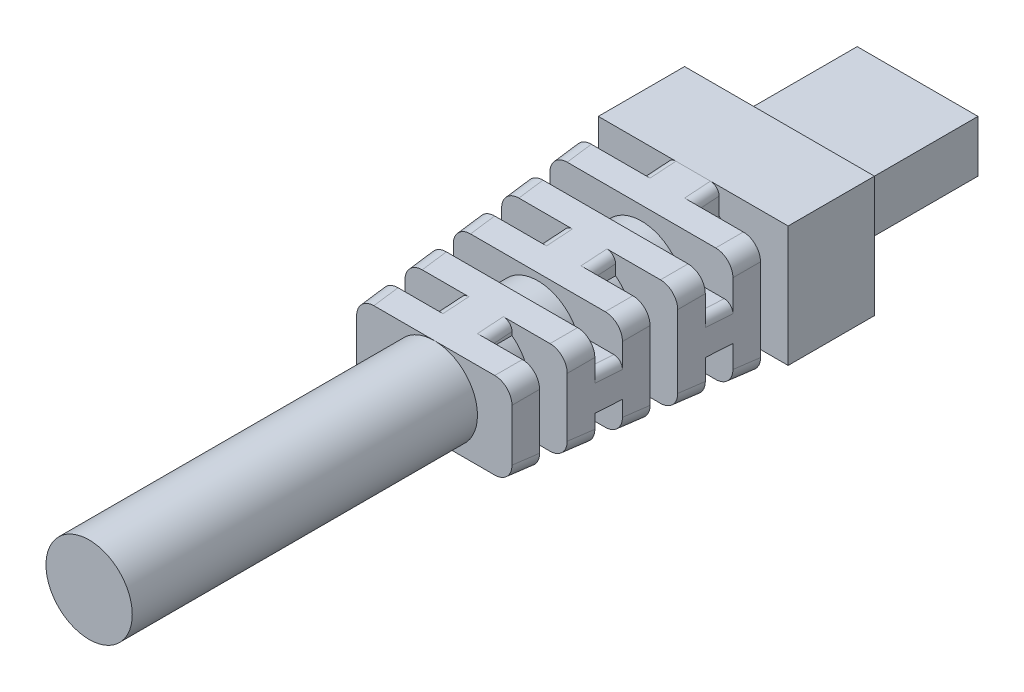
from build123d import *
from OCP.BRepFilletAPI import BRepFilletAPI_MakeChamfer

# Parameters (mm, degrees)
SKETCH1_W                = 7
SKETCH1_H                = 3
BOSS_EXTRUDE1_DEPTH      = 8
SKETCH2_W                = 11
SKETCH2_H                = 7
BOSS_EXTRUDE2_DEPTH      = 20
CHAMFER2_SIZE            = 15
CHAMFER2_SIZE2           = 1
SKETCH5_W                = 1.5
SKETCH5_H                = 2.5
CUT_EXTRUDE2_DEPTH       = 4
FILLET2_R                = 1
SKETCH6_W                = 1.5
SKETCH6_H                = 2
CUT_EXTRUDE3_DEPTH       = 4
SKETCH7_W                = 3
SKETCH7_H                = 1.5
CUT_EXTRUDE4_DEPTH       = 2.5
BOSS_EXTRUDE4_DEPTH      = 20
BOSS_EXTRUDE4_DEPTH_BACK = 20
SKETCH8_R                = 2.5
FILLET3_R                = 0.5


with BuildPart() as part:
    # Sketch1 → Boss-Extrude1 (new body)
    with BuildSketch(Plane.XY):
        with Locations((-57.846738576, -21.572369878)):
            Rectangle(SKETCH1_W, SKETCH1_H)
    extrude(amount=BOSS_EXTRUDE1_DEPTH)

    # Sketch2 → Boss-Extrude2 (add)
    with BuildSketch(Plane.XY.offset(8)):
        with Locations((-57.846738576, -21.572369878)):
            Rectangle(SKETCH2_W, SKETCH2_H)
    extrude(amount=BOSS_EXTRUDE2_DEPTH)

    # Chamfer2: one chamfer whose edges measure the first distance from different faces: ONE call of the kernel's chamfer builder (chamfer() names one face for all edges)
    chamfer2_edges_1 = [part.edges().sort_by_distance(p)[0] for p in [
        (-63.346738576, -21.572369878, 28),
    ]]
    chamfer2_side_1 = [part.faces().sort_by_distance(p)[0] for p in [
        (-63.346738576, -21.572369878, 18),
    ]]
    chamfer2_edges_2 = [part.edges().sort_by_distance(p)[0] for p in [
        (-57.846738576, -25.072369878, 28),
    ]]
    chamfer2_side_2 = [part.faces().sort_by_distance(p)[0] for p in [
        (-57.846738576, -25.072369878, 18),
    ]]
    chamfer2_edges_3 = [part.edges().sort_by_distance(p)[0] for p in [
        (-52.346738576, -21.572369878, 28),
    ]]
    chamfer2_side_3 = [part.faces().sort_by_distance(p)[0] for p in [
        (-52.346738576, -21.572369878, 18),
    ]]
    chamfer2_edges_4 = [part.edges().sort_by_distance(p)[0] for p in [
        (-57.846738576, -18.072369878, 28),
    ]]
    chamfer2_side_4 = [part.faces().sort_by_distance(p)[0] for p in [
        (-57.846738576, -18.072369878, 18),
    ]]
    chamfer2 = BRepFilletAPI_MakeChamfer(part.part.solid().wrapped)
    for e in chamfer2_edges_1:
        chamfer2.Add(CHAMFER2_SIZE, CHAMFER2_SIZE2, e.wrapped, chamfer2_side_1[0].wrapped)  # the first distance lies on this face
    for e in chamfer2_edges_2:
        chamfer2.Add(CHAMFER2_SIZE, CHAMFER2_SIZE2, e.wrapped, chamfer2_side_2[0].wrapped)  # the first distance lies on this face
    for e in chamfer2_edges_3:
        chamfer2.Add(CHAMFER2_SIZE, CHAMFER2_SIZE2, e.wrapped, chamfer2_side_3[0].wrapped)  # the first distance lies on this face
    for e in chamfer2_edges_4:
        chamfer2.Add(CHAMFER2_SIZE, CHAMFER2_SIZE2, e.wrapped, chamfer2_side_4[0].wrapped)  # the first distance lies on this face
    add(Compound.cast(chamfer2.Shape()), mode=Mode.REPLACE)

    # Sketch5 → Cut-Extrude2 (cut)
    with BuildSketch(Plane(origin=(-52.346738576, 0, 0), x_dir=(0, 0, -1), z_dir=(1, 0, 0))):
        with Locations((-25.75, -19.322369878)):
            Rectangle(SKETCH5_W, SKETCH5_H)
        with Locations((-22.75, -19.322369878)):
            Rectangle(SKETCH5_W, SKETCH5_H)
        with Locations((-19.75, -19.322369878)):
            Rectangle(SKETCH5_W, SKETCH5_H)
        with Locations((-16.75, -19.322369878)):
            Rectangle(SKETCH5_W, SKETCH5_H)
        with Locations((-13.75, -19.322369878)):
            Rectangle(SKETCH5_W, SKETCH5_H)
        with Locations((-22.75, -23.822369878)):
            Rectangle(SKETCH5_W, SKETCH5_H)
        with Locations((-19.75, -23.822369878)):
            Rectangle(SKETCH5_W, SKETCH5_H)
        with Locations((-16.75, -23.822369878)):
            Rectangle(SKETCH5_W, SKETCH5_H)
        with Locations((-13.75, -23.822369878)):
            Rectangle(SKETCH5_W, SKETCH5_H)
        with Locations((-25.75, -23.822369878)):
            Rectangle(SKETCH5_W, SKETCH5_H)
    cut_extrude2 = extrude(amount=-CUT_EXTRUDE2_DEPTH, mode=Mode.SUBTRACT)

    # Mirror2: Cut-Extrude2 across plane
    add(cut_extrude2.mirror(Plane(origin=(-57.846738576, 0, 0), x_dir=(0, 0, 1), z_dir=(1, 0, 0))), mode=Mode.SUBTRACT)

    # Fillet2
    fillet2_edges = [part.edges().sort_by_distance(p)[0] for p in [
        (-52.496738576, -18.222369878, 15.25),
        (-53.096738576, -24.322369878, 24.25),
        (-52.896738576, -24.522369878, 21.25),
        (-52.696738576, -24.722369878, 18.25),
        (-52.496738576, -24.922369878, 15.25),
        (-53.296738576, -24.122369878, 27.25),
        (-62.596738576, -18.822369878, 24.25),
        (-62.796738576, -18.622369878, 21.25),
        (-62.996738576, -18.422369878, 18.25),
        (-63.196738576, -18.222369878, 15.25),
        (-62.796738576, -24.522369878, 21.25),
        (-62.996738576, -24.722369878, 18.25),
        (-63.196738576, -24.922369878, 15.25),
        (-62.396738576, -19.022369878, 27.25),
        (-62.396738576, -24.122369878, 27.25),
        (-62.596738576, -24.322369878, 24.25),
        (-53.296738576, -19.022369878, 27.25),
        (-53.096738576, -18.822369878, 24.25),
        (-52.896738576, -18.622369878, 21.25),
        (-52.696738576, -18.422369878, 18.25),
    ]]
    fillet(fillet2_edges, radius=FILLET2_R)

    # Sketch6 → Cut-Extrude3 (cut)
    with BuildSketch(Plane.ZY.offset(63.346738576)):
        with Locations((13.75, -21.572369878)):
            Rectangle(SKETCH6_W, SKETCH6_H)
        with Locations((19.75, -21.572369878)):
            Rectangle(SKETCH6_W, SKETCH6_H)
        with Locations((25.75, -21.572369878)):
            Rectangle(SKETCH6_W, SKETCH6_H)
    cut_extrude3 = extrude(amount=-CUT_EXTRUDE3_DEPTH, mode=Mode.SUBTRACT)

    # Mirror3: Cut-Extrude3 across plane
    add(cut_extrude3.mirror(Plane(origin=(-57.846738576, 0, 0), x_dir=(0, 0, 1), z_dir=(1, 0, 0))), mode=Mode.SUBTRACT)

    # Sketch7 → Cut-Extrude4 (cut)
    with BuildSketch(Plane(origin=(0, -18.072369878, 0), x_dir=(1, 0, 0), z_dir=(0, 1, 0))):
        with Locations((-57.846738576, -16.75)):
            Rectangle(SKETCH7_W, SKETCH7_H)
        with Locations((-57.846738576, -22.75)):
            Rectangle(SKETCH7_W, SKETCH7_H)
    cut_extrude4 = extrude(amount=-CUT_EXTRUDE4_DEPTH, mode=Mode.SUBTRACT)

    # Mirror4: Cut-Extrude4 across plane
    add(cut_extrude4.mirror(Plane.ZX.offset(-21.572369878)), mode=Mode.SUBTRACT)

    # Sketch8 → Boss-Extrude4 (add, two sides: drawn at the far end of the back side and taken through both)
    with BuildSketch(Plane.XY.offset(28).offset(-BOSS_EXTRUDE4_DEPTH_BACK)):
        with Locations(Location((-57.846738576, -21.572369878, 0), (0, 0, 270))):
            Circle(SKETCH8_R)
    extrude(amount=BOSS_EXTRUDE4_DEPTH + BOSS_EXTRUDE4_DEPTH_BACK)

    # Fillet3
    # the kernel refuses this fillet: 0.5 mm, written as the material it adds along each edge
    with BuildSketch(Plane(origin=(-59.346738576, -23.572369878, 12.409830056), x_dir=(0, -1, 0), z_dir=(0, 0, 1))) as fillet3_piece_1:
        with BuildLine():
            CenterArc((0.236067977, -0.5), FILLET3_R, 90, 48.189685104)
            ThreePointArc((-0.136610019, -0.166666667), (-0.066508345, -0.084805988), (0, 0))
            Line((0, 0), (0.236067977, 0))
        make_face()
    extrude(amount=2.680339887)
    with BuildSketch(Plane(origin=(-59.346738576, -19.572369878, 12.409830056), x_dir=(-0.7733966621339653, -0.633922395092681, 0), z_dir=(0, 0, 1))) as fillet3_piece_2:
        with BuildLine():
            CenterArc((0.237049553, -0.499535383), FILLET3_R, 92.470208625, 48.189685104)
            Line((-0.149648778, -0.182574186), (0, 0))
            ThreePointArc((0, 0), (0.107749797, -0.002323083), (0.215499594, 0))
        make_face()
    extrude(amount=2.680339887)
    with BuildSketch(Plane(origin=(-59.346738576, -19.572369878, 18.409830056), x_dir=(0, 1, 0), z_dir=(0, 0, 1))) as fillet3_piece_3:
        with BuildLine():
            CenterArc((0.236067977, 0.5), FILLET3_R, 221.810314896, 48.189685104)
            ThreePointArc((-0.136610019, 0.166666667), (-0.066508345, 0.084805988), (0, 0))
            Line((0, 0), (0.236067977, 0))
        make_face()
    extrude(amount=2.680339887)
    with BuildSketch(Plane(origin=(-60.138026424, -20.572369878, 21.23302909), x_dir=(0.45070755855689565, 0.8926716622922913, 0), z_dir=(0, 0, 1))) as fillet3_piece_4:
        with BuildLine():
            CenterArc((0.308063997, 0.499215058), FILLET3_R, 206.789089239, 60)
            Line((-0.138271834, 0.273861279), (0, 0))
            ThreePointArc((0, 0), (0.140029089, 0.00392471), (0.280058179, 0))
        make_face()
    extrude(amount=3.033941819)
    # the kernel refuses this fillet: 0.5 mm, written as the material it takes off along each edge
    with BuildSketch(Plane(origin=(-56.346738576, -18.255518641, 15.747231447), x_dir=(-1, 0, 0), z_dir=(0, 0.06651901052377394, -0.9977851578566089))) as fillet3_2_piece_1_section:
        with BuildLine():
            CenterArc((FILLET3_R, -FILLET3_R), FILLET3_R, 90, 90)
            Line((0, -FILLET3_R), (0, 0))
            Line((0, 0), (FILLET3_R, 0))
        make_face()
    fillet3_2_piece_1 = extrude(amount=4.003329638, mode=Mode.PRIVATE)
    fillet3_2_piece_1 = split(fillet3_2_piece_1, bisect_by=Plane(origin=(-56.459936133, -18.235818707, 14.5), z_dir=(0, 0, -1)), keep=Keep.TOP, mode=Mode.PRIVATE)
    fillet3_2_piece_1 = split(fillet3_2_piece_1, bisect_by=Plane(origin=(-56.459936133, -18.235818707, 13), z_dir=(0, 0, 1)), keep=Keep.TOP, mode=Mode.PRIVATE)
    add(fillet3_2_piece_1, mode=Mode.SUBTRACT)
    with BuildSketch(Plane(origin=(-56.346738576, -24.755518641, 17.752768553), x_dir=(-1, 0, 0), z_dir=(0, 0.06651901052377394, 0.9977851578566089))) as fillet3_2_piece_2_section:
        with BuildLine():
            CenterArc((FILLET3_R, -FILLET3_R), FILLET3_R, 90, 90)
            Line((0, -FILLET3_R), (0, 0))
            Line((0, 0), (FILLET3_R, 0))
        make_face()
    fillet3_2_piece_2 = extrude(amount=4.003329638, mode=Mode.PRIVATE)
    fillet3_2_piece_2 = split(fillet3_2_piece_2, bisect_by=Plane(origin=(-56.459936133, -24.50892105, 19), z_dir=(0, 0, 1)), keep=Keep.TOP, mode=Mode.PRIVATE)
    fillet3_2_piece_2 = split(fillet3_2_piece_2, bisect_by=Plane(origin=(-56.459936133, -24.50892105, 20.5), z_dir=(0, 0, -1)), keep=Keep.TOP, mode=Mode.PRIVATE)
    add(fillet3_2_piece_2, mode=Mode.SUBTRACT)
    with BuildSketch(Plane(origin=(-56.346738576, -25.155518641, 11.752768553), x_dir=(-1, 0, 0), z_dir=(0, 0.06651901052377394, 0.9977851578566089))) as fillet3_2_piece_3_section:
        with BuildLine():
            CenterArc((FILLET3_R, -FILLET3_R), FILLET3_R, 90, 90)
            Line((0, -FILLET3_R), (0, 0))
            Line((0, 0), (FILLET3_R, 0))
        make_face()
    fillet3_2_piece_3 = extrude(amount=4.003329638, mode=Mode.PRIVATE)
    fillet3_2_piece_3 = split(fillet3_2_piece_3, bisect_by=Plane(origin=(-56.459936133, -24.90892105, 14.5), z_dir=(0, 0, -1)), keep=Keep.TOP, mode=Mode.PRIVATE)
    fillet3_2_piece_3 = split(fillet3_2_piece_3, bisect_by=Plane(origin=(-56.459936133, -24.90892105, 13), z_dir=(0, 0, 1)), keep=Keep.TOP, mode=Mode.PRIVATE)
    add(fillet3_2_piece_3, mode=Mode.SUBTRACT)
    with BuildSketch(Plane(origin=(-56.346738576, -24.355518641, 23.752768553), x_dir=(-1, 0, 0), z_dir=(0, 0.06651901052377394, 0.9977851578566089))) as fillet3_2_piece_4_section:
        with BuildLine():
            CenterArc((FILLET3_R, -FILLET3_R), FILLET3_R, 90, 90)
            Line((0, -FILLET3_R), (0, 0))
            Line((0, 0), (FILLET3_R, 0))
        make_face()
    fillet3_2_piece_4 = extrude(amount=4.003329638, mode=Mode.PRIVATE)
    fillet3_2_piece_4 = split(fillet3_2_piece_4, bisect_by=Plane(origin=(-56.459936133, -24.10892105, 25), z_dir=(0, 0, 1)), keep=Keep.TOP, mode=Mode.PRIVATE)
    fillet3_2_piece_4 = split(fillet3_2_piece_4, bisect_by=Plane(origin=(-56.459936133, -24.10892105, 26.5), z_dir=(0, 0, -1)), keep=Keep.TOP, mode=Mode.PRIVATE)
    add(fillet3_2_piece_4, mode=Mode.SUBTRACT)
    with BuildSketch(Plane(origin=(-59.346738576, -19.055518641, 27.747231447), x_dir=(1, 0, 0), z_dir=(0, 0.06651901052377394, -0.9977851578566089))) as fillet3_2_piece_5_section:
        with BuildLine():
            CenterArc((FILLET3_R, FILLET3_R), FILLET3_R, 180, 90)
            Line((0, FILLET3_R), (0, 0))
            Line((0, 0), (FILLET3_R, 0))
        make_face()
    fillet3_2_piece_5 = extrude(amount=4.003329638, mode=Mode.PRIVATE)
    fillet3_2_piece_5 = split(fillet3_2_piece_5, bisect_by=Plane(origin=(-59.233541019, -19.035818707, 25), z_dir=(0, 0, 1)), keep=Keep.TOP, mode=Mode.PRIVATE)
    fillet3_2_piece_5 = split(fillet3_2_piece_5, bisect_by=Plane(origin=(-59.233541019, -19.035818707, 26.5), z_dir=(0, 0, -1)), keep=Keep.TOP, mode=Mode.PRIVATE)
    add(fillet3_2_piece_5, mode=Mode.SUBTRACT)
    with BuildSketch(Plane(origin=(-62.563589813, -20.572369878, 24.747231447), x_dir=(0, -1, 0), z_dir=(-0.06651901052377394, 0, -0.9977851578566089))) as fillet3_2_piece_6_section:
        with BuildLine():
            CenterArc((FILLET3_R, -FILLET3_R), FILLET3_R, 90, 90)
            Line((0, -FILLET3_R), (0, 0))
            Line((0, 0), (FILLET3_R, 0))
        make_face()
    fillet3_2_piece_6 = extrude(amount=4.003329638, mode=Mode.PRIVATE)
    fillet3_2_piece_6 = split(fillet3_2_piece_6, bisect_by=Plane(origin=(-62.583289748, -20.685567435, 22), z_dir=(0, 0, 1)), keep=Keep.TOP, mode=Mode.PRIVATE)
    fillet3_2_piece_6 = split(fillet3_2_piece_6, bisect_by=Plane(origin=(-62.583289748, -20.685567435, 23.5), z_dir=(0, 0, -1)), keep=Keep.TOP, mode=Mode.PRIVATE)
    add(fillet3_2_piece_6, mode=Mode.SUBTRACT)
    with BuildSketch(Plane(origin=(-59.346738576, -18.655518641, 21.747231447), x_dir=(1, 0, 0), z_dir=(0, 0.06651901052377394, -0.9977851578566089))) as fillet3_2_piece_7_section:
        with BuildLine():
            CenterArc((FILLET3_R, FILLET3_R), FILLET3_R, 180, 90)
            Line((0, FILLET3_R), (0, 0))
            Line((0, 0), (FILLET3_R, 0))
        make_face()
    fillet3_2_piece_7 = extrude(amount=4.003329638, mode=Mode.PRIVATE)
    fillet3_2_piece_7 = split(fillet3_2_piece_7, bisect_by=Plane(origin=(-59.233541019, -18.635818707, 19), z_dir=(0, 0, 1)), keep=Keep.TOP, mode=Mode.PRIVATE)
    fillet3_2_piece_7 = split(fillet3_2_piece_7, bisect_by=Plane(origin=(-59.233541019, -18.635818707, 20.5), z_dir=(0, 0, -1)), keep=Keep.TOP, mode=Mode.PRIVATE)
    add(fillet3_2_piece_7, mode=Mode.SUBTRACT)
    with BuildSketch(Plane(origin=(-62.963589813, -20.572369878, 18.747231447), x_dir=(0, -1, 0), z_dir=(-0.06651901052377394, 0, -0.9977851578566089))) as fillet3_2_piece_8_section:
        with BuildLine():
            CenterArc((FILLET3_R, -FILLET3_R), FILLET3_R, 90, 90)
            Line((0, -FILLET3_R), (0, 0))
            Line((0, 0), (FILLET3_R, 0))
        make_face()
    fillet3_2_piece_8 = extrude(amount=4.003329638, mode=Mode.PRIVATE)
    fillet3_2_piece_8 = split(fillet3_2_piece_8, bisect_by=Plane(origin=(-62.983289748, -20.685567435, 16), z_dir=(0, 0, 1)), keep=Keep.TOP, mode=Mode.PRIVATE)
    fillet3_2_piece_8 = split(fillet3_2_piece_8, bisect_by=Plane(origin=(-62.983289748, -20.685567435, 17.5), z_dir=(0, 0, -1)), keep=Keep.TOP, mode=Mode.PRIVATE)
    add(fillet3_2_piece_8, mode=Mode.SUBTRACT)
    with BuildSketch(Plane(origin=(-59.346738576, -18.255518641, 15.747231447), x_dir=(1, 0, 0), z_dir=(0, 0.06651901052377394, -0.9977851578566089))) as fillet3_2_piece_9_section:
        with BuildLine():
            CenterArc((FILLET3_R, FILLET3_R), FILLET3_R, 180, 90)
            Line((0, FILLET3_R), (0, 0))
            Line((0, 0), (FILLET3_R, 0))
        make_face()
    fillet3_2_piece_9 = extrude(amount=4.003329638, mode=Mode.PRIVATE)
    fillet3_2_piece_9 = split(fillet3_2_piece_9, bisect_by=Plane(origin=(-59.233541019, -18.235818707, 14.5), z_dir=(0, 0, -1)), keep=Keep.TOP, mode=Mode.PRIVATE)
    fillet3_2_piece_9 = split(fillet3_2_piece_9, bisect_by=Plane(origin=(-59.233541019, -18.235818707, 13), z_dir=(0, 0, 1)), keep=Keep.TOP, mode=Mode.PRIVATE)
    add(fillet3_2_piece_9, mode=Mode.SUBTRACT)
    with BuildSketch(Plane(origin=(-62.829887339, -22.572369878, 20.752768553), x_dir=(0, 1, 0), z_dir=(0.06651901052377394, 0, 0.9977851578566089))) as fillet3_2_piece_10_section:
        with BuildLine():
            CenterArc((FILLET3_R, -FILLET3_R), FILLET3_R, 90, 90)
            Line((0, -FILLET3_R), (0, 0))
            Line((0, 0), (FILLET3_R, 0))
        make_face()
    fillet3_2_piece_10 = extrude(amount=4.003329638, mode=Mode.PRIVATE)
    fillet3_2_piece_10 = split(fillet3_2_piece_10, bisect_by=Plane(origin=(-62.583289748, -22.459172321, 22), z_dir=(0, 0, 1)), keep=Keep.TOP, mode=Mode.PRIVATE)
    fillet3_2_piece_10 = split(fillet3_2_piece_10, bisect_by=Plane(origin=(-62.583289748, -22.459172321, 23.5), z_dir=(0, 0, -1)), keep=Keep.TOP, mode=Mode.PRIVATE)
    add(fillet3_2_piece_10, mode=Mode.SUBTRACT)
    with BuildSketch(Plane(origin=(-59.346738576, -24.755518641, 17.752768553), x_dir=(1, 0, 0), z_dir=(0, 0.06651901052377394, 0.9977851578566089))) as fillet3_2_piece_11_section:
        with BuildLine():
            CenterArc((FILLET3_R, FILLET3_R), FILLET3_R, 180, 90)
            Line((0, FILLET3_R), (0, 0))
            Line((0, 0), (FILLET3_R, 0))
        make_face()
    fillet3_2_piece_11 = extrude(amount=4.003329638, mode=Mode.PRIVATE)
    fillet3_2_piece_11 = split(fillet3_2_piece_11, bisect_by=Plane(origin=(-59.233541019, -24.50892105, 19), z_dir=(0, 0, 1)), keep=Keep.TOP, mode=Mode.PRIVATE)
    fillet3_2_piece_11 = split(fillet3_2_piece_11, bisect_by=Plane(origin=(-59.233541019, -24.50892105, 20.5), z_dir=(0, 0, -1)), keep=Keep.TOP, mode=Mode.PRIVATE)
    add(fillet3_2_piece_11, mode=Mode.SUBTRACT)
    with BuildSketch(Plane(origin=(-63.229887339, -22.572369878, 14.752768553), x_dir=(0, 1, 0), z_dir=(0.06651901052377394, 0, 0.9977851578566089))) as fillet3_2_piece_12_section:
        with BuildLine():
            CenterArc((FILLET3_R, -FILLET3_R), FILLET3_R, 90, 90)
            Line((0, -FILLET3_R), (0, 0))
            Line((0, 0), (FILLET3_R, 0))
        make_face()
    fillet3_2_piece_12 = extrude(amount=4.003329638, mode=Mode.PRIVATE)
    fillet3_2_piece_12 = split(fillet3_2_piece_12, bisect_by=Plane(origin=(-62.983289748, -22.459172321, 16), z_dir=(0, 0, 1)), keep=Keep.TOP, mode=Mode.PRIVATE)
    fillet3_2_piece_12 = split(fillet3_2_piece_12, bisect_by=Plane(origin=(-62.983289748, -22.459172321, 17.5), z_dir=(0, 0, -1)), keep=Keep.TOP, mode=Mode.PRIVATE)
    add(fillet3_2_piece_12, mode=Mode.SUBTRACT)
    with BuildSketch(Plane(origin=(-59.346738576, -25.155518641, 11.752768553), x_dir=(0, 0.997785157856609, -0.06651901052377394), z_dir=(0, 0.06651901052377394, 0.9977851578566089))) as fillet3_2_piece_13_section:
        with BuildLine():
            CenterArc((FILLET3_R, -FILLET3_R), FILLET3_R, 90, 90)
            Line((0, -FILLET3_R), (0, 0))
            Line((0, 0), (FILLET3_R, 0))
        make_face()
    fillet3_2_piece_13 = extrude(amount=4.003329638, mode=Mode.PRIVATE)
    fillet3_2_piece_13 = split(fillet3_2_piece_13, bisect_by=Plane(origin=(-59.233541019, -24.90892105, 14.5), z_dir=(0, 0, -1)), keep=Keep.TOP, mode=Mode.PRIVATE)
    fillet3_2_piece_13 = split(fillet3_2_piece_13, bisect_by=Plane(origin=(-59.233541019, -24.90892105, 13), z_dir=(0, 0, 1)), keep=Keep.TOP, mode=Mode.PRIVATE)
    add(fillet3_2_piece_13, mode=Mode.SUBTRACT)
    with BuildSketch(Plane(origin=(-59.346738576, -24.355518641, 23.752768553), x_dir=(1, 0, 0), z_dir=(0, 0.06651901052377394, 0.9977851578566089))) as fillet3_2_piece_14_section:
        with BuildLine():
            CenterArc((FILLET3_R, FILLET3_R), FILLET3_R, 180, 90)
            Line((0, FILLET3_R), (0, 0))
            Line((0, 0), (FILLET3_R, 0))
        make_face()
    fillet3_2_piece_14 = extrude(amount=4.003329638, mode=Mode.PRIVATE)
    fillet3_2_piece_14 = split(fillet3_2_piece_14, bisect_by=Plane(origin=(-59.233541019, -24.10892105, 25), z_dir=(0, 0, 1)), keep=Keep.TOP, mode=Mode.PRIVATE)
    fillet3_2_piece_14 = split(fillet3_2_piece_14, bisect_by=Plane(origin=(-59.233541019, -24.10892105, 26.5), z_dir=(0, 0, -1)), keep=Keep.TOP, mode=Mode.PRIVATE)
    add(fillet3_2_piece_14, mode=Mode.SUBTRACT)
    with BuildSketch(Plane(origin=(-56.346738576, -19.055518641, 27.747231447), x_dir=(0, -0.997785157856609, -0.06651901052377394), z_dir=(0, 0.06651901052377394, -0.9977851578566089))) as fillet3_2_piece_15_section:
        with BuildLine():
            CenterArc((FILLET3_R, FILLET3_R), FILLET3_R, 180, 90)
            Line((0, FILLET3_R), (0, 0))
            Line((0, 0), (FILLET3_R, 0))
        make_face()
    fillet3_2_piece_15 = extrude(amount=4.003329638, mode=Mode.PRIVATE)
    fillet3_2_piece_15 = split(fillet3_2_piece_15, bisect_by=Plane(origin=(-56.459936133, -19.035818707, 25), z_dir=(0, 0, 1)), keep=Keep.TOP, mode=Mode.PRIVATE)
    fillet3_2_piece_15 = split(fillet3_2_piece_15, bisect_by=Plane(origin=(-56.459936133, -19.035818707, 26.5), z_dir=(0, 0, -1)), keep=Keep.TOP, mode=Mode.PRIVATE)
    add(fillet3_2_piece_15, mode=Mode.SUBTRACT)
    with BuildSketch(Plane(origin=(-53.129887339, -20.572369878, 24.747231447), x_dir=(0, -1, 0), z_dir=(0.06651901052377394, 0, -0.9977851578566089))) as fillet3_2_piece_16_section:
        with BuildLine():
            CenterArc((FILLET3_R, FILLET3_R), FILLET3_R, 180, 90)
            Line((0, FILLET3_R), (0, 0))
            Line((0, 0), (FILLET3_R, 0))
        make_face()
    fillet3_2_piece_16 = extrude(amount=4.003329638, mode=Mode.PRIVATE)
    fillet3_2_piece_16 = split(fillet3_2_piece_16, bisect_by=Plane(origin=(-53.110187404, -20.685567435, 22), z_dir=(0, 0, 1)), keep=Keep.TOP, mode=Mode.PRIVATE)
    fillet3_2_piece_16 = split(fillet3_2_piece_16, bisect_by=Plane(origin=(-53.110187404, -20.685567435, 23.5), z_dir=(0, 0, -1)), keep=Keep.TOP, mode=Mode.PRIVATE)
    add(fillet3_2_piece_16, mode=Mode.SUBTRACT)
    with BuildSketch(Plane(origin=(-56.346738576, -18.655518641, 21.747231447), x_dir=(-1, 0, 0), z_dir=(0, 0.06651901052377394, -0.9977851578566089))) as fillet3_2_piece_17_section:
        with BuildLine():
            CenterArc((FILLET3_R, -FILLET3_R), FILLET3_R, 90, 90)
            Line((0, -FILLET3_R), (0, 0))
            Line((0, 0), (FILLET3_R, 0))
        make_face()
    fillet3_2_piece_17 = extrude(amount=4.003329638, mode=Mode.PRIVATE)
    fillet3_2_piece_17 = split(fillet3_2_piece_17, bisect_by=Plane(origin=(-56.459936133, -18.635818707, 19), z_dir=(0, 0, 1)), keep=Keep.TOP, mode=Mode.PRIVATE)
    fillet3_2_piece_17 = split(fillet3_2_piece_17, bisect_by=Plane(origin=(-56.459936133, -18.635818707, 20.5), z_dir=(0, 0, -1)), keep=Keep.TOP, mode=Mode.PRIVATE)
    add(fillet3_2_piece_17, mode=Mode.SUBTRACT)
    with BuildSketch(Plane(origin=(-52.729887339, -20.572369878, 18.747231447), x_dir=(-0.997785157856609, 0, -0.06651901052377394), z_dir=(0.06651901052377394, 0, -0.9977851578566089))) as fillet3_2_piece_18_section:
        with BuildLine():
            CenterArc((FILLET3_R, -FILLET3_R), FILLET3_R, 90, 90)
            Line((0, -FILLET3_R), (0, 0))
            Line((0, 0), (FILLET3_R, 0))
        make_face()
    fillet3_2_piece_18 = extrude(amount=4.003329638, mode=Mode.PRIVATE)
    fillet3_2_piece_18 = split(fillet3_2_piece_18, bisect_by=Plane(origin=(-52.710187404, -20.685567435, 16), z_dir=(0, 0, 1)), keep=Keep.TOP, mode=Mode.PRIVATE)
    fillet3_2_piece_18 = split(fillet3_2_piece_18, bisect_by=Plane(origin=(-52.710187404, -20.685567435, 17.5), z_dir=(0, 0, -1)), keep=Keep.TOP, mode=Mode.PRIVATE)
    add(fillet3_2_piece_18, mode=Mode.SUBTRACT)


solid = part.part
